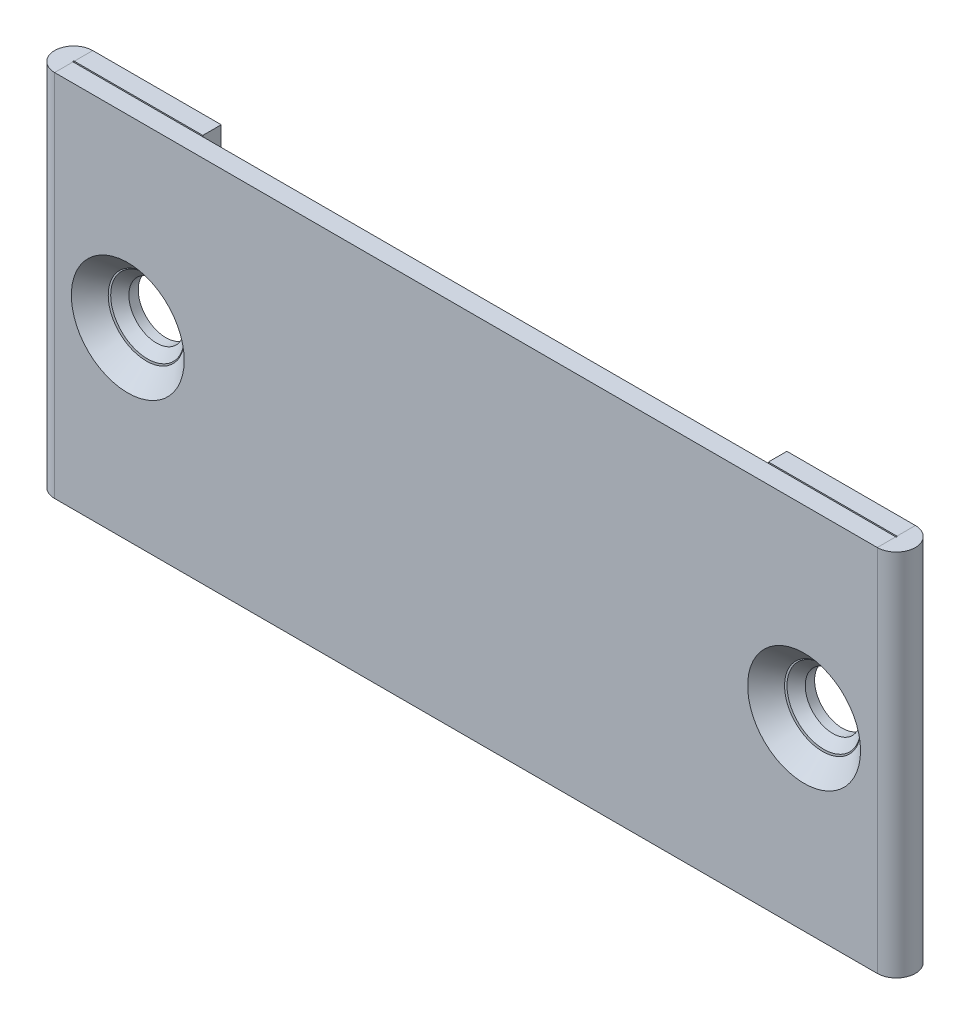
from build123d import *

# Parameters (mm, degrees)
SKETCH_2_W                  = 70
SKETCH_2_H                  = 30
SM_BASE_FLANGE_1_DEPTH      = 1.5
OTHER_START                 = -15
OTHER_1_DEPTH               = 30
OTHER_1_2_DEPTH             = 30
HOLE_WIZARD_M4_1_AT_2_COUNT = 2
HOLE_WIZARD_M4_1_AT_2_PITCH = 55


# Read off the part's stored shape, not the designer's step: 褶边1
# Sheet-metal steps are written as plain solids
with BuildPart() as part:
    # 草图2 → 基体-法兰1 (new body)
    with BuildSketch(Plane.XY):
        Rectangle(SKETCH_2_W, SKETCH_2_H)
    extrude(amount=-SM_BASE_FLANGE_1_DEPTH)

    # Other 1 outline → Other 1 (cut)
    with BuildSketch(Plane(origin=(0, 0, 0), x_dir=(1, 0, 0), z_dir=(0, 1, 0)).offset(OTHER_START)):
        with BuildLine():
            Line((35, 1.5), (34.999193338, 1.5))
            ThreePointArc((34.999193338, 1.5), (34.528192933, 0.436447127), (33.45, 0))
            Line((33.45, 0), (35, 0))
            Line((35, 0), (35, 1.5))
        make_face()
        with BuildLine():
            ThreePointArc((-33.45, 0), (-34.528192933, 0.436447127), (-34.999193338, 1.5))
            Line((-34.999193338, 1.5), (-35, 1.5))
            Line((-35, 1.5), (-35, 0))
            Line((-35, 0), (-33.45, 0))
        make_face()
    extrude(amount=OTHER_1_DEPTH, mode=Mode.SUBTRACT)

    # Other 1 2 outline → Other 1 2 (add)
    with BuildSketch(Plane(origin=(0, 0, 0), x_dir=(1, 0, 0), z_dir=(0, 1, 0)).offset(OTHER_START)):
        with BuildLine():
            Line((23, 3.1), (23, 1.6))
            Line((23, 1.6), (33.45, 1.6))
            ThreePointArc((33.45, 1.6), (33.5, 1.55), (33.45, 1.5))
            Line((33.45, 1.5), (34.999193338, 1.5))
            ThreePointArc((34.999193338, 1.5), (34.563552873, 2.628192933), (33.45, 3.1))
            Line((33.45, 3.1), (23, 3.1))
        make_face()
        with BuildLine():
            Line((-34.999193338, 1.5), (-33.45, 1.5))
            ThreePointArc((-33.45, 1.5), (-33.5, 1.55), (-33.45, 1.6))
            Line((-33.45, 1.6), (-23, 1.6))
            Line((-23, 1.6), (-23, 3.1))
            Line((-23, 3.1), (-33.45, 3.1))
            ThreePointArc((-33.45, 3.1), (-34.563552873, 2.628192933), (-34.999193338, 1.5))
        make_face()
    extrude(amount=OTHER_1_2_DEPTH)

    # 草图9 → M4 六角凹锥坑头螺钉的锥形沉头孔1 (revolve, cut)
    with BuildSketch(Plane(origin=(27.5, 0, 0), x_dir=(0, -1, 0), z_dir=(1, 0, 0))):
        Polygon((0, 0), (0, 3.1), (2.25, 3.1), (2.25, 2.34), (4.59, 0), align=None)
    hole_wizard_m4_1 = revolve(axis=Axis((27.5, 0, 6.35), (0, 0, -1)), mode=Mode.SUBTRACT)

    # M4 六角凹锥坑头螺钉的锥形沉头孔1 at 2: M4 六角凹锥坑头螺钉的锥形沉头孔1 ×2
    with Locations(*[(-i * HOLE_WIZARD_M4_1_AT_2_PITCH, 0, 0) for i in range(1, HOLE_WIZARD_M4_1_AT_2_COUNT)]):
        add(hole_wizard_m4_1, mode=Mode.SUBTRACT)


solid = part.part
